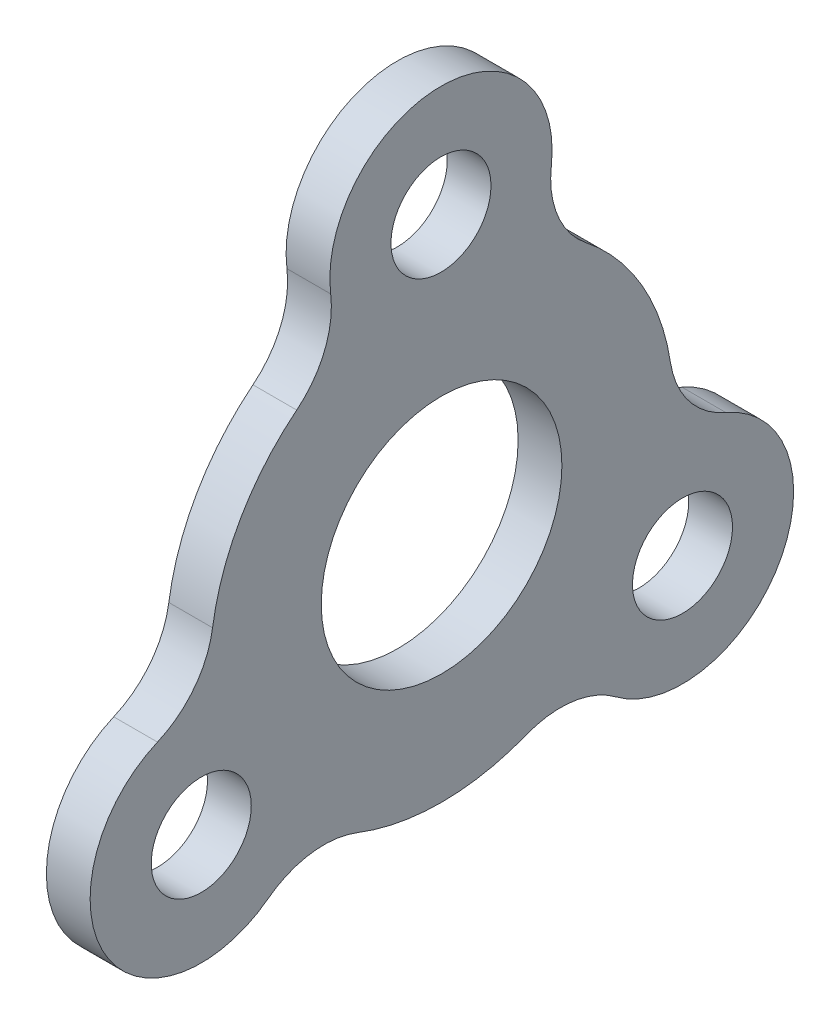
from build123d import *

# Parameters (mm, degrees)
SKETCH1_R           = 8.25000001
SKETCH1_R_2         = 3.429
BOSS_EXTRUDE1_DEPTH = 3


with BuildPart() as part:
    # Sketch1 → Boss-Extrude1 (new body)
    with BuildSketch(Plane(origin=(0, 0, 0), x_dir=(0, 0, -1), z_dir=(1, 0, 0))):
        with BuildLine():
            ThreePointArc((-9.932721486, 12.383725969), (-13.765287617, 7.907748214), (-15.701260011, 2.34223378))
            ThreePointArc((-15.701260011, 2.34223378), (-16.953395244, -0.598759698), (-19.479664725, -2.557138565))
            ThreePointArc((-19.479664725, -2.557138565), (-23.068003809, -13.384920629), (-11.886828766, -15.642876888))
            ThreePointArc((-11.886828766, -15.642876888), (-8.932943645, -14.421464604), (-5.75826054, -14.79385212))
            ThreePointArc((-5.75826054, -14.79385212), (0.034332969, -15.874962874), (5.82219605, -14.76880693))
            ThreePointArc((5.82219605, -14.76880693), (8.995238731, -14.382691113), (11.954379321, -15.591315227))
            ThreePointArc((11.954379321, -15.591315227), (23.125683197, -13.285016999), (19.490543157, -2.472857238))
            ThreePointArc((19.490543157, -2.472857238), (16.955826529, -0.525423825), (15.690982026, 2.410126151))
            ThreePointArc((15.690982026, 2.410126151), (13.730954648, 7.96721466), (9.87906396, 12.426573151))
            ThreePointArc((9.87906396, 12.426573151), (7.958156513, 14.981450811), (7.525285405, 18.148453792))
            ThreePointArc((7.525285405, 18.148453792), (-0.057679388, 26.669937628), (-7.603714391, 18.115734126))
            ThreePointArc((-7.603714391, 18.115734126), (-8.022882884, 14.946888429), (-9.932721486, 12.383725969))
        make_face()
        Circle(SKETCH1_R, mode=Mode.SUBTRACT)
        with Locations((-0.041199563, 19.049955449)):
            Circle(SKETCH1_R_2, mode=Mode.SUBTRACT)
        with Locations((-16.477145578, -9.560657592)):
            Circle(SKETCH1_R_2, mode=Mode.SUBTRACT)
        with Locations((16.518345141, -9.489297856)):
            Circle(SKETCH1_R_2, mode=Mode.SUBTRACT)
    extrude(amount=BOSS_EXTRUDE1_DEPTH)


solid = part.part
